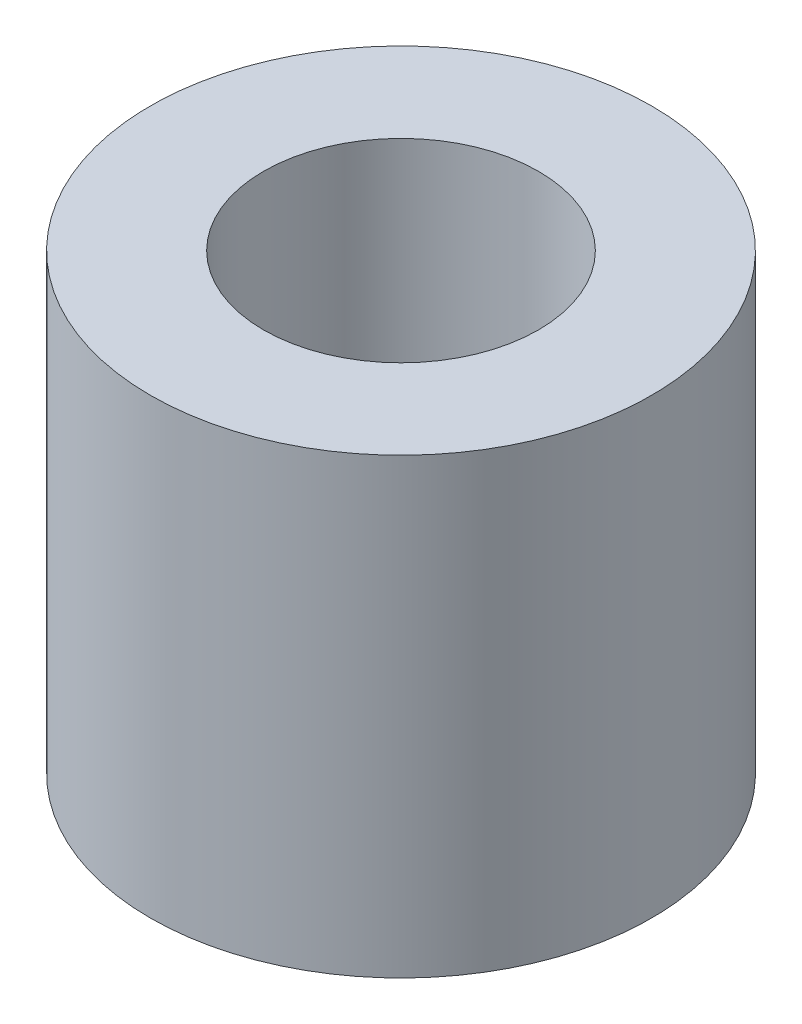
from build123d import *

# Parameters (mm, degrees)
SKETCH1_R           = 3.875
SKETCH1_R_2         = 2.125
BOSS_EXTRUDE1_DEPTH = 7


with BuildPart() as part:
    # Sketch1 → Boss-Extrude1 (new body)
    with BuildSketch(Plane(origin=(0, 0, 0), x_dir=(1, 0, 0), z_dir=(0, 1, 0))):
        Circle(SKETCH1_R)
        Circle(SKETCH1_R_2, mode=Mode.SUBTRACT)
    extrude(amount=BOSS_EXTRUDE1_DEPTH)


solid = part.part
